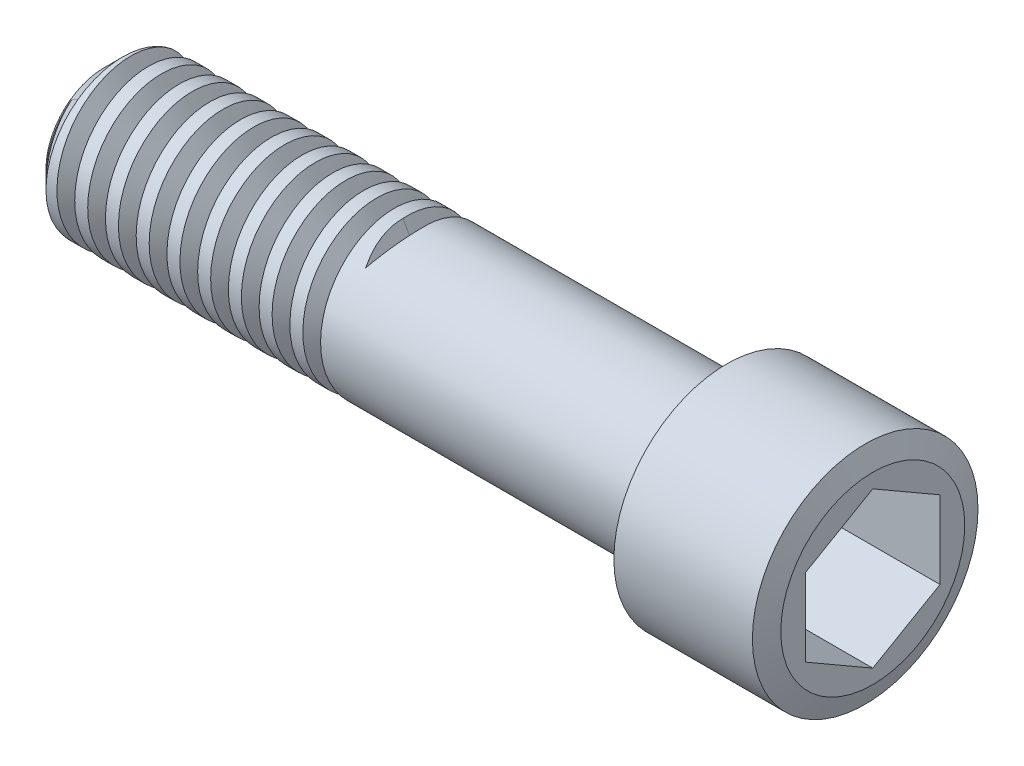
from build123d import *

# Parameters (mm, degrees)
CUT_SWEEP1_PITCH   = 1.27
CUT_EXTRUDE2_DEPTH = 18.189054826
CUT_EXTRUDE3_DEPTH = 4.7625


with BuildPart() as part:
    # Sketch1 → Revolve1 (revolve)
    with BuildSketch(Plane.XY, mode=Mode.PRIVATE) as revolve1_sk:
        Polygon((-15.875, 0), (-15.875, 2.413), (-15.113, 3.175), (9.525, 3.175), (9.525, 5.55625), (9.837852386, 6.415804866), (15.562147614, 6.415804866), (15.875, 5.55625), (15.875, 0), align=None)
    revolve(revolve1_sk.sketch.rotate(Axis((-15.875, 0, 0), (1, 0, 0)), 180), axis=Axis((-15.875, 0, 0), (1, 0, 0)))

    # Sketch6 → Cut-Revolve1 (revolve, cut)
    with BuildSketch(Plane.XY, mode=Mode.PRIVATE) as cut_revolve1_sk:
        Polygon((9.525, 3.801345134), (9.837852386, 4.6609), (15.562147614, 4.6609), (15.875, 3.801345134), (15.875, 6.415804866), (9.525, 6.415804866), align=None)
    revolve(cut_revolve1_sk.sketch.rotate(Axis((9.525, 0, 0), (1, 0, 0)), 90), axis=Axis((9.525, 0, 0), (1, 0, 0)), mode=Mode.SUBTRACT)

    # Cut-Sweep1: the profile of Sketch4 profile screwed along a right-hand helix of 10 turns, 8 arcs to a turn; built about Z, then put on its axis
    cut_sweep1_z = Axis((0, 0, 0), (0, 0, 1))
    cut_sweep1_corners = [(3.1753, 0, -0.366790626), (3.1753, 0, 0.366790626), (2.54, 0, 0)]
    with BuildLine(mode=Mode.PRIVATE) as cut_sweep1_profile:
        Line(cut_sweep1_corners[0], cut_sweep1_corners[1])
        Line(cut_sweep1_corners[1], cut_sweep1_corners[2])
        Line(cut_sweep1_corners[2], cut_sweep1_corners[0])
    cut_sweep1_cap = Face(cut_sweep1_profile.wire())
    cut_sweep1_turn_angles = [0, 22.5, 45, 67.5, 90, 112.5, 135, 157.5, 180, 202.5, 225, 247.5, 270, 292.5, 315, 337.5, 360]
    cut_sweep1_turn_weights = [1, 0.9238795325112867, 1, 0.9238795325112867, 1, 0.9238795325112867, 1, 0.9238795325112867, 1, 0.9238795325112867, 1, 0.9238795325112867, 1, 0.9238795325112867, 1, 0.9238795325112867, 1]
    cut_sweep1_turn_rails = [Edge.make_bspline([Vector(p[0], p[1], 0).rotate(cut_sweep1_z, cut_sweep1_turn_angles[k]) / cut_sweep1_turn_weights[k] + Vector(0, 0, p[2] + CUT_SWEEP1_PITCH * cut_sweep1_turn_angles[k] / 360) for k in range(17)], [0, 0, 0, 1, 1, 2, 2, 3, 3, 4, 4, 5, 5, 6, 6, 7, 7, 8, 8, 8], 2, cut_sweep1_turn_weights) for p in cut_sweep1_corners]
    cut_sweep1_turn_sides = [Face.make_surface_from_curves(cut_sweep1_turn_rails[p[0]], cut_sweep1_turn_rails[p[1]]) for p in [(0, 1), (1, 2), (2, 0)]]
    cut_sweep1 = Plane(origin=(-15.875, 0, 0), x_dir=(0, 1, 0), z_dir=(1, 0, 0)) * Solid(Shell([*[p.moved(Location((0, 0, CUT_SWEEP1_PITCH * i))) for i in range(10) for p in cut_sweep1_turn_sides], cut_sweep1_cap, cut_sweep1_cap.rotate(cut_sweep1_z, 3600).moved(Location((0, 0, CUT_SWEEP1_PITCH * 3600 / 360)))]))
    add(cut_sweep1, mode=Mode.SUBTRACT)

    # Sketch5 → Cut-Extrude2 (cut, through all)
    with BuildSketch(Plane(origin=(0, 0, 0), x_dir=(-1, 0, 0), z_dir=(0, 0, -1))):
        Polygon((2.808382579, 3.175), (3.175, 2.54), (3.541617421, 3.175), align=None)
    extrude(amount=-CUT_EXTRUDE2_DEPTH, mode=Mode.SUBTRACT)

    # Sketch7 → Cut-Extrude3 (cut)
    with BuildSketch(Plane(origin=(15.875, 0, 0), x_dir=(0, 0, -1), z_dir=(1, 0, 0))):
        Polygon((0, -3.207902433), (2.778125, -1.603951217), (2.778125, 1.603951217), (0, 3.207902433), (-2.778125, 1.603951217), (-2.778125, -1.603951217), align=None)
    extrude(amount=-CUT_EXTRUDE3_DEPTH, mode=Mode.SUBTRACT)


solid = part.part
